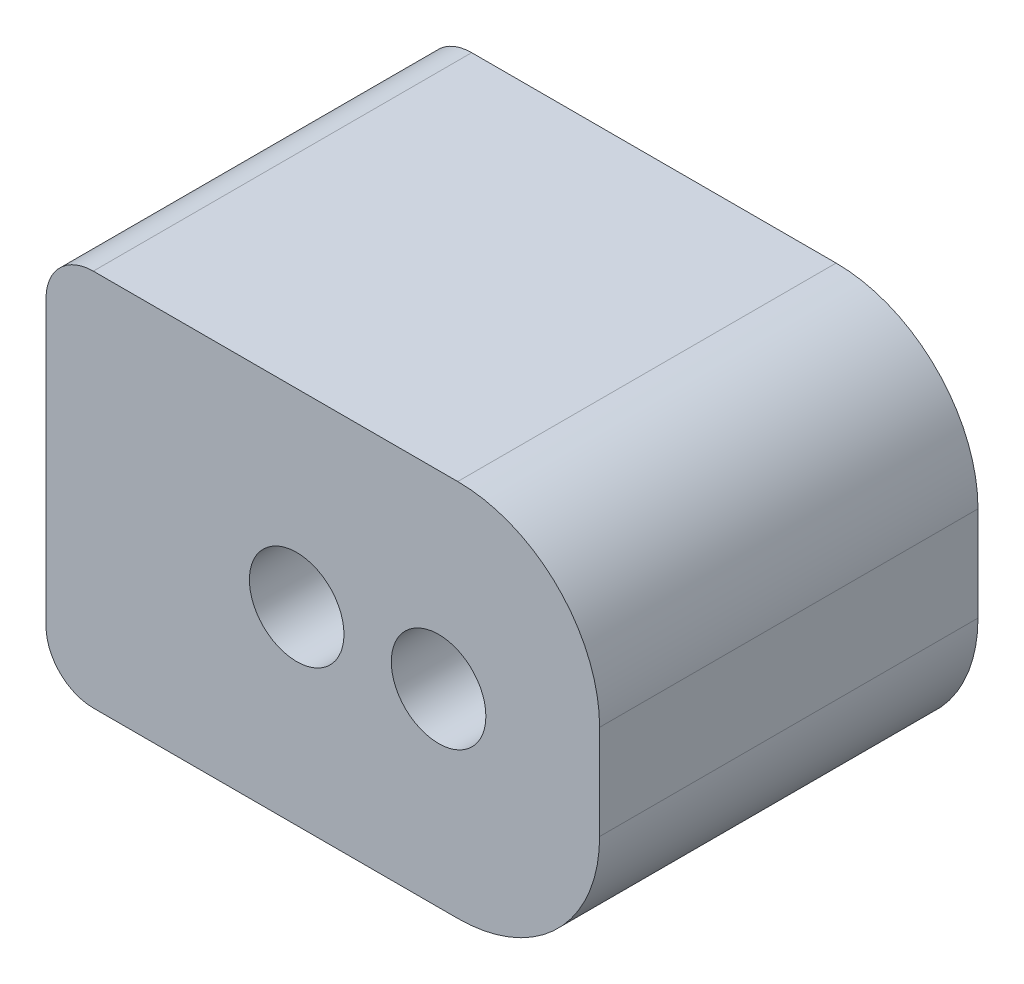
from build123d import *

# Parameters (mm, degrees)
SKETCH1_W           = 11.70451268
SKETCH1_H           = 8
SKETCH1_R           = 1
BOSS_EXTRUDE1_DEPTH = 8
CUT_EXTRUDE3_START  = -0.8
SKETCH4_R           = 3.25
CUT_EXTRUDE3_DEPTH  = 2.7
FILLET2_R           = 1
FILLET3_R           = 3


with BuildPart() as part:
    # Sketch1 → Boss-Extrude1 (new body)
    with BuildSketch(Plane.XY):
        with Locations((0.55225634, 0)):
            Rectangle(SKETCH1_W, SKETCH1_H)
        Circle(SKETCH1_R, mode=Mode.SUBTRACT)
        with Locations((3, 0)):
            Circle(SKETCH1_R, mode=Mode.SUBTRACT)
    extrude(amount=BOSS_EXTRUDE1_DEPTH)

    # Sketch4 → Cut-Extrude3 (cut)
    with BuildSketch(Plane.ZY.offset(5.3).offset(CUT_EXTRUDE3_START)):
        with Locations((4, 0)):
            Circle(SKETCH4_R)
    extrude(amount=-CUT_EXTRUDE3_DEPTH, mode=Mode.SUBTRACT)

    # Fillet2
    fillet2_edges = [part.edges().sort_by_distance(p)[0] for p in [
        (-5.3, -4, 4),
        (-5.3, 4, 4),
    ]]
    fillet(fillet2_edges, radius=FILLET2_R)

    # Fillet3
    fillet3_edges = [part.edges().sort_by_distance(p)[0] for p in [
        (6.40451268, -4, 4),
        (6.40451268, 4, 4),
    ]]
    fillet(fillet3_edges, radius=FILLET3_R)


solid = part.part
